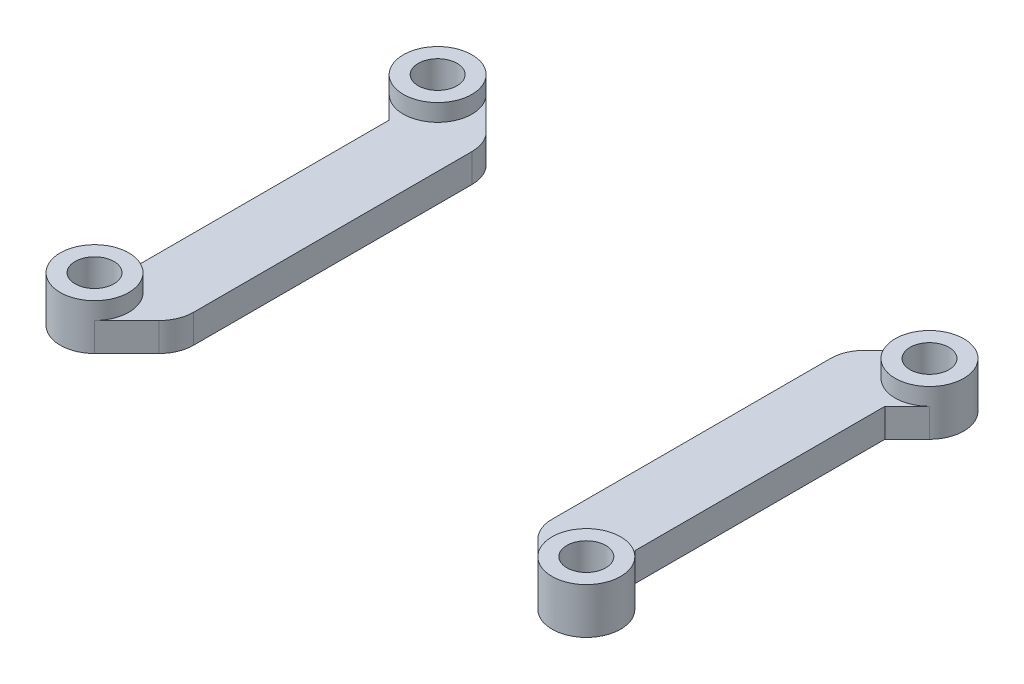
from build123d import *

# Parameters (mm, degrees)
SKETCH1_R               = 3
SKETCH1_R_2             = 1.7
BOSS_EXTRUDE1_DEPTH     = 4
BOSS_EXTRUDE1_2_DEPTH   = 4
BOSS_EXTRUDE1_3_DEPTH   = 4
BOSS_EXTRUDE1_4_DEPTH   = 4
BOSS_EXTRUDE2_DEPTH     = 2.5
CUT_EXTRUDE1_DEPTH      = 31.663496213
CUT_EXTRUDE1_DEPTH_BACK = 31.663496213
SKETCH1_2_R             = 1.7


with BuildPart() as part:
    # Sketch1 → Boss-Extrude1 (new body)
    with BuildSketch(Plane(origin=(0, 0, 0), x_dir=(1, 0, 0), z_dir=(0, 1, 0))):
        with Locations((-21.5, 15)):
            Circle(SKETCH1_R)
        with Locations((-21.5, 15)):
            Circle(SKETCH1_R_2, mode=Mode.SUBTRACT)
    extrude(amount=BOSS_EXTRUDE1_DEPTH)



with BuildPart() as body_2:
    # Sketch1 → Boss-Extrude1 2 (new body)
    with BuildSketch(Plane(origin=(0, 0, 0), x_dir=(1, 0, 0), z_dir=(0, 1, 0))):
        with Locations((-21.5, -15)):
            Circle(SKETCH1_R)
        with Locations((-21.5, -15)):
            Circle(SKETCH1_R_2, mode=Mode.SUBTRACT)
    extrude(amount=BOSS_EXTRUDE1_2_DEPTH)


with BuildPart() as body_3:
    # Sketch1 → Boss-Extrude1 3 (new body)
    with BuildSketch(Plane(origin=(0, 0, 0), x_dir=(1, 0, 0), z_dir=(0, 1, 0))):
        with Locations((21.5, -15)):
            Circle(SKETCH1_R)
        with Locations((21.5, -15)):
            Circle(SKETCH1_R_2, mode=Mode.SUBTRACT)
    extrude(amount=BOSS_EXTRUDE1_3_DEPTH)


with BuildPart() as body_4:
    # Sketch1 → Boss-Extrude1 4 (new body)
    with BuildSketch(Plane(origin=(0, 0, 0), x_dir=(1, 0, 0), z_dir=(0, 1, 0))):
        with Locations((21.5, 15)):
            Circle(SKETCH1_R)
        with Locations((21.5, 15)):
            Circle(SKETCH1_R_2, mode=Mode.SUBTRACT)
    extrude(amount=BOSS_EXTRUDE1_4_DEPTH)


with BuildPart() as part_1:
    add(part.part)

    add(body_2.part)  # Boss-Extrude2 merges body 2

    add(body_3.part)  # Boss-Extrude2 merges body 3

    add(body_4.part)  # Boss-Extrude2 merges body 4
    # Sketch2 → Boss-Extrude2 (add)
    with BuildSketch(Plane(origin=(0, 0, 0), x_dir=(1, 0, 0), z_dir=(0, 1, 0))):
        with BuildLine():
            Line((-16.550252532, 14.292893219), (-19.378679656, 17.121320344))
            ThreePointArc((-19.378679656, 17.121320344), (-23.621320344, 17.121320344), (-23.621320344, 12.878679656))
            Line((-23.621320344, 12.878679656), (-21.671572875, 10.928932188))
            Line((-21.671572875, 10.928932188), (-21.671572875, -10.928932188))
            Line((-21.671572875, -10.928932188), (-23.621320344, -12.878679656))
            ThreePointArc((-23.621320344, -12.878679656), (-23.621320344, -17.121320344), (-19.378679656, -17.121320344))
            Line((-19.378679656, -17.121320344), (-16.550252532, -14.292893219))
            ThreePointArc((-16.550252532, -14.292893219), (-15.899934278, -13.319623172), (-15.671572875, -12.171572875))
            Line((-15.671572875, -12.171572875), (-15.671572875, 12.171572875))
            ThreePointArc((-15.671572875, 12.171572875), (-15.899934278, 13.319623172), (-16.550252532, 14.292893219))
        make_face()
        with BuildLine():
            Line((21.671572875, -10.928932188), (21.671572875, 10.928932188))
            Line((21.671572875, 10.928932188), (23.621320344, 12.878679656))
            ThreePointArc((23.621320344, 12.878679656), (23.621320344, 17.121320344), (19.378679656, 17.121320344))
            Line((19.378679656, 17.121320344), (16.550252532, 14.292893219))
            ThreePointArc((16.550252532, 14.292893219), (15.899934278, 13.319623172), (15.671572875, 12.171572875))
            Line((15.671572875, 12.171572875), (15.671572875, -12.171572875))
            ThreePointArc((15.671572875, -12.171572875), (15.899934278, -13.319623172), (16.550252532, -14.292893219))
            Line((16.550252532, -14.292893219), (19.378679656, -17.121320344))
            ThreePointArc((19.378679656, -17.121320344), (23.621320344, -17.121320344), (23.621320344, -12.878679656))
            Line((23.621320344, -12.878679656), (21.671572875, -10.928932188))
        make_face()
    extrude(amount=BOSS_EXTRUDE2_DEPTH)

    # Sketch1<2> → Cut-Extrude1 (cut, two sides: drawn at the far end of the back side and taken through both)
    with BuildSketch(Plane(origin=(0, 0, 0), x_dir=(1, 0, 0), z_dir=(0, 1, 0)).offset(-CUT_EXTRUDE1_DEPTH_BACK)):
        with Locations((-21.5, 15)):
            Circle(SKETCH1_2_R)
        with Locations((21.5, 15)):
            Circle(SKETCH1_2_R)
        with Locations((21.5, -15)):
            Circle(SKETCH1_2_R)
        with Locations((-21.5, -15)):
            Circle(SKETCH1_2_R)
    extrude(amount=CUT_EXTRUDE1_DEPTH + CUT_EXTRUDE1_DEPTH_BACK, mode=Mode.SUBTRACT)


solid = part_1.part
